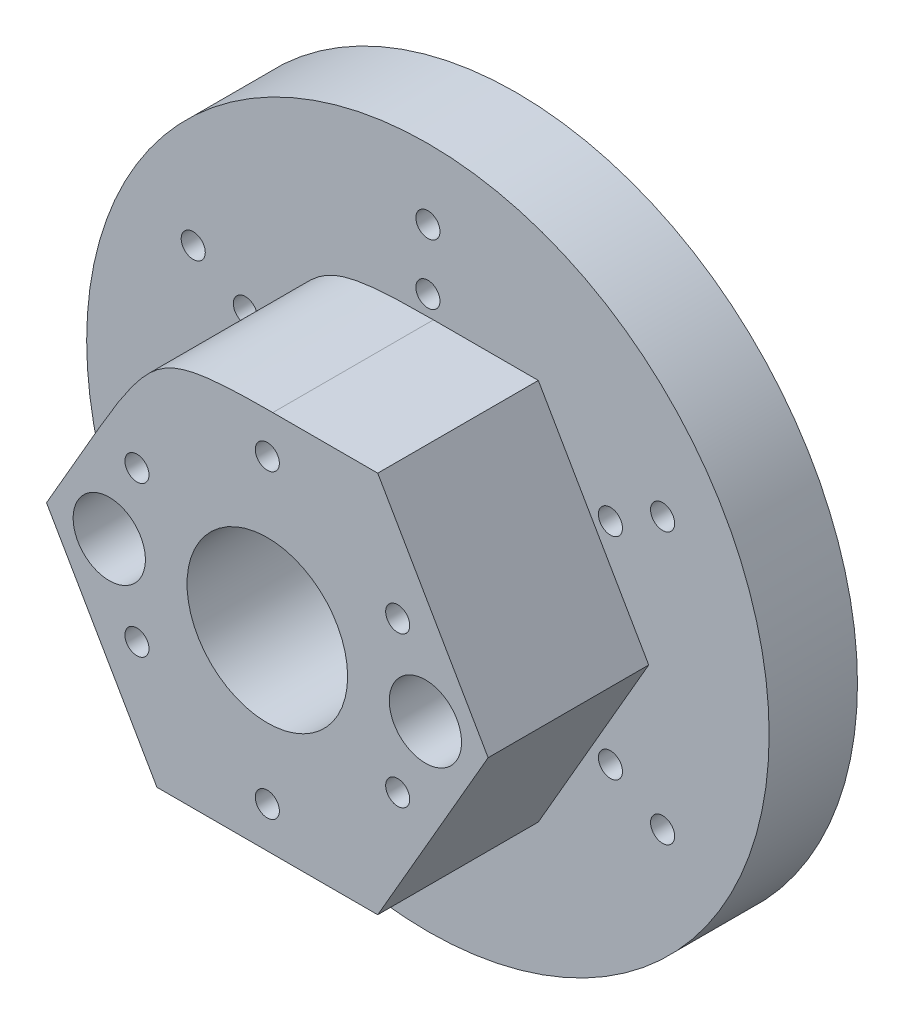
from build123d import *

# Parameters (mm, degrees)
SKETCH1_R               = 17
BOSS_EXTRUDE1_DEPTH     = 4.4
CAVITY1_OUTLINE_R       = 3.15
CAVITY1_DEPTH           = 3.283595969
CAVITY1_START           = 1.183595969
CAVITY1_2_OUTLINE_R     = 3.15
CAVITY1_2_OUTLINE_R_2   = 1.575
CAVITY1_2_DEPTH         = 2.1
BOSS_EXTRUDE8_DEPTH     = 8
SKETCH2_R               = 0.6
CUT_EXTRUDE1_DEPTH      = 28.051062826
CIRPATTERN1_COUNT       = 6
CUT_EXTRUDE2_START      = -3.283596
SKETCH3_R               = 4.596048158
CUT_EXTRUDE2_DEPTH      = 3.283596
CUT_EXTRUDE3_DEPTH      = 28.051062826
CUT_EXTRUDE3_DEPTH_BACK = 4
SKETCH4_R               = 4
SKETCH6_R               = 1.8
CUT_EXTRUDE4_DEPTH      = 28.051062826


with BuildPart() as part:
    # Sketch1 → Boss-Extrude1 (new body)
    with BuildSketch(Plane.XY):
        Circle(SKETCH1_R)
    extrude(amount=BOSS_EXTRUDE1_DEPTH)

    # Cavity1: read off the stored shape, not the designer's step
    # Cavity1 outline → Cavity1 (cut)
    with BuildSketch(Plane.XY):
        with BuildLine():
            Line((3.9375, 6.819950055), (2.048148228, 15.163776711))
            ThreePointArc((2.048148228, 15.163776711), (0, 16.8), (-2.048148228, 15.163776711))
            Line((-2.048148228, 15.163776711), (-3.9375, 6.819950055))
            Line((-3.9375, 6.819950055), (-12.108141735, 9.355636751))
            ThreePointArc((-12.108141735, 9.355636751), (-14.549226784, 8.4), (-14.156289963, 5.80813996))
            Line((-14.156289963, 5.80813996), (-7.875, 0))
            Line((-7.875, 0), (-14.156289963, -5.80813996))
            ThreePointArc((-14.156289963, -5.80813996), (-14.549226784, -8.4), (-12.108141735, -9.355636751))
            Line((-12.108141735, -9.355636751), (-3.9375, -6.819950055))
            Line((-3.9375, -6.819950055), (-2.048148228, -15.163776711))
            ThreePointArc((-2.048148228, -15.163776711), (0, -16.8), (2.048148228, -15.163776711))
            Line((2.048148228, -15.163776711), (3.9375, -6.819950055))
            Line((3.9375, -6.819950055), (12.108141735, -9.355636751))
            ThreePointArc((12.108141735, -9.355636751), (14.549226784, -8.4), (14.156289963, -5.80813996))
            Line((14.156289963, -5.80813996), (7.875, 0))
            Line((7.875, 0), (14.156289963, 5.80813996))
            ThreePointArc((14.156289963, 5.80813996), (14.549226784, 8.4), (12.108141735, 9.355636751))
            Line((12.108141735, 9.355636751), (3.9375, 6.819950055))
        make_face()
        Circle(CAVITY1_OUTLINE_R, mode=Mode.SUBTRACT)
    extrude(amount=CAVITY1_DEPTH, mode=Mode.SUBTRACT)

    # Cavity1 2 outline → Cavity1 2 (cut)
    with BuildSketch(Plane.XY.offset(CAVITY1_START)):
        Circle(CAVITY1_2_OUTLINE_R)
        Circle(CAVITY1_2_OUTLINE_R_2, mode=Mode.SUBTRACT)
    extrude(amount=CAVITY1_2_DEPTH, mode=Mode.SUBTRACT)

    # Sketch12 → Boss-Extrude8 (add)
    with BuildSketch(Plane.XY.offset(4.4)):
        Polygon((5.5, -9.526279442), (11, 0), (5.5, 9.526279442), (-5.5, 9.526279442), (-11, 0), (-5.5, -9.526279442), align=None)
    extrude(amount=BOSS_EXTRUDE8_DEPTH)

    # Sketch2 → Cut-Extrude1 (cut, through all)
    with BuildSketch(Plane(origin=(0, 0, 0), x_dir=(-1, 0, 0), z_dir=(0, 0, -1))):
        with Locations(Location((0, 13.5, 0), (0, 0, 180))):
            Circle(SKETCH2_R)
        with Locations(Location((0, 10.5, 0), (0, 0, 180))):
            Circle(SKETCH2_R)
        with Locations((0, 7.5)):
            Circle(SKETCH2_R)
    cut_extrude1 = extrude(amount=-CUT_EXTRUDE1_DEPTH, mode=Mode.SUBTRACT)

    # CirPattern1: Cut-Extrude1 ×6 about axis
    cirpattern1_axis = Axis((0, 0, 0), (0, 0, 1))
    for i in range(1, CIRPATTERN1_COUNT):
        add(cut_extrude1.rotate(cirpattern1_axis, i * 360 / CIRPATTERN1_COUNT), mode=Mode.SUBTRACT)

    # Sketch3 → Cut-Extrude2 (cut)
    with BuildSketch(Plane(origin=(0, 0, 0), x_dir=(-1, 0, 0), z_dir=(0, 0, -1)).offset(CUT_EXTRUDE2_START)):
        Circle(SKETCH3_R)
    extrude(amount=CUT_EXTRUDE2_DEPTH, mode=Mode.SUBTRACT)

    # Sketch4 → Cut-Extrude3 (cut, two sides: drawn at the far end of the back side and taken through both)
    with BuildSketch(Plane.XY.offset(-CUT_EXTRUDE3_DEPTH_BACK)):
        Circle(SKETCH4_R)
    extrude(amount=CUT_EXTRUDE3_DEPTH + CUT_EXTRUDE3_DEPTH_BACK, mode=Mode.SUBTRACT)

    # Sketch6 → Cut-Extrude4 (cut, through all)
    with BuildSketch(Plane(origin=(0, 0, 0), x_dir=(-1, 0, 0), z_dir=(0, 0, -1))):
        with Locations((-7.875, 0)):
            Circle(SKETCH6_R)
        with Locations((7.875, 0)):
            Circle(SKETCH6_R)
    extrude(amount=-CUT_EXTRUDE4_DEPTH, mode=Mode.SUBTRACT)

    # Fillet1
    # a fillet whose section is not a circle: 10 mm, written as the material it takes off along each edge
    with BuildSketch(Plane(origin=(-5.5, 9.526279442, 4.4), x_dir=(1, 0, 0), z_dir=(0, 0, 1))) as fillet1_piece_1:
        with BuildLine():
            Bezier((5.773502692, 0), (0, 0), (-2.886751346, -5), weights=[1, 2.333333333, 1])
            Line((-2.886751346, -5), (0, 0))
            Line((0, 0), (5.773502692, 0))
        make_face()
    extrude(amount=22.43375673, mode=Mode.SUBTRACT)


solid = part.part
